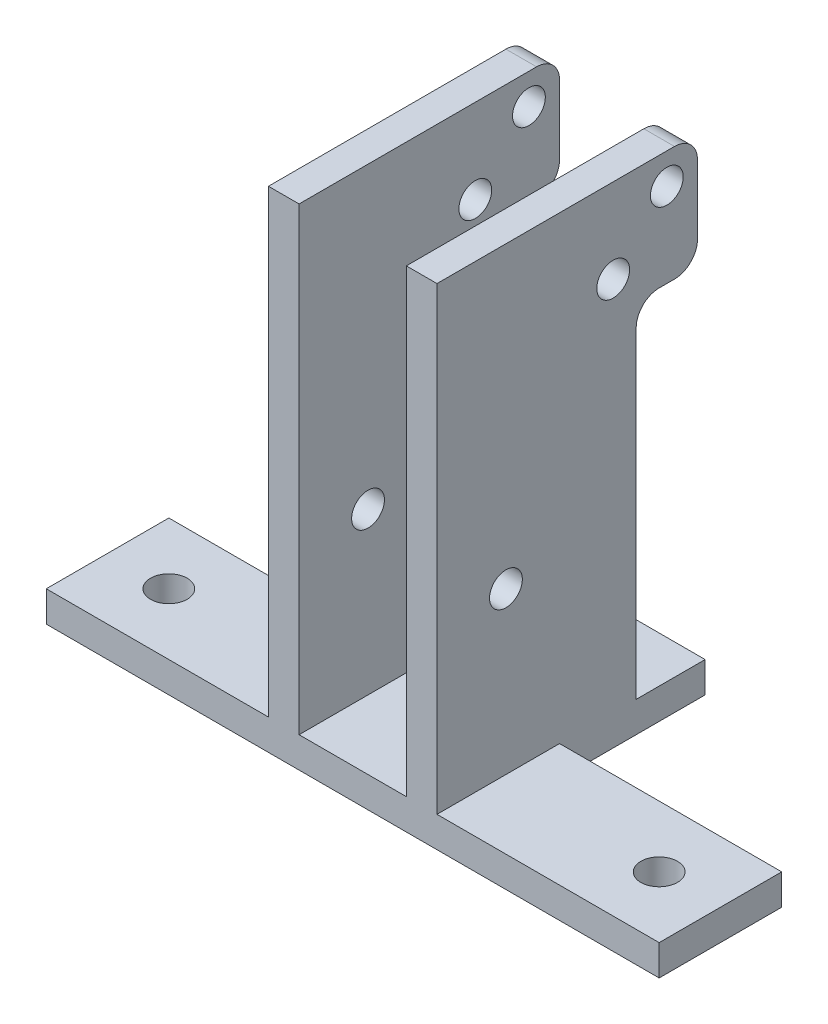
from build123d import *

# Parameters (mm, degrees)
SKETCH1_W             = 63.5
SKETCH1_H             = 6.35
BOSS_EXTRUDE1_DEPTH   = 3.175
F_6_CLEARANCE_HOLE1_D = 3.7973
SKETCH7_W             = 17.4625
SKETCH7_H             = 27.78125
BOSS_EXTRUDE2_DEPTH   = 3.175
SKETCH9_W             = 3.175
SKETCH9_H             = 20.6375
BOSS_EXTRUDE3_DEPTH   = 44.45
M3_CLEARANCE_HOLE1_D  = 3.4
SKETCH14_W            = 20.6375
SKETCH14_H            = 6.35
BOSS_EXTRUDE4_DEPTH   = 3.175
FILLET3_R             = 2.38125
M3_CLEARANCE_HOLE2_D  = 3.4
MIRROR1_START         = -8.73125
MIRROR1_OUTLINE_R     = 1.7
MIRROR1_DEPTH         = 3.175


# Read off the part's stored shape, not the designer's step: Mirror1
with BuildPart() as part:
    # Sketch1 → Boss-Extrude1 (new body)
    with BuildSketch(Plane(origin=(0, 0, 0), x_dir=(1, 0, 0), z_dir=(0, 1, 0))):
        with Locations((0, -3.175)):
            Rectangle(SKETCH1_W, SKETCH1_H)
        with Locations((0, 3.175)):
            Rectangle(SKETCH1_W, SKETCH1_H)
    extrude(amount=BOSS_EXTRUDE1_DEPTH)

    # #6 Clearance Hole1 (through all)
    with Locations(Plane(origin=(0, 0, 0), x_dir=(-1, 0, 0), z_dir=(0, -1, 0))):
        with Locations((25.4, 0), (-25.4, 0)):
            Hole(F_6_CLEARANCE_HOLE1_D / 2)

    # Sketch7 → Boss-Extrude2 (add)
    with BuildSketch(Plane.XZ):
        with Locations((0, -7.540625)):
            Rectangle(SKETCH7_W, SKETCH7_H)
    extrude(amount=-BOSS_EXTRUDE2_DEPTH)

    # Sketch9 → Boss-Extrude3 (add)
    with BuildSketch(Plane.XZ):
        with Locations((7.14375, -3.96875)):
            Rectangle(SKETCH9_W, SKETCH9_H)
        with Locations((-7.14375, -3.96875)):
            Rectangle(SKETCH9_W, SKETCH9_H)
    extrude(amount=-BOSS_EXTRUDE3_DEPTH)

    # M3 Clearance Hole1 (through all)
    with Locations(Plane(origin=(8.73125, 0, 0), x_dir=(0, 0, -1), z_dir=(1, 0, 0))):
        with Locations((0.79375, 19.84375), (11.90625, 42.06875)):
            Hole(M3_CLEARANCE_HOLE1_D / 2)

    # Sketch14 → Boss-Extrude4 (add)
    with BuildSketch(Plane(origin=(8.73125, 0, 0), x_dir=(0, 0, -1), z_dir=(1, 0, 0))):
        with Locations((3.96875, 47.625)):
            Rectangle(SKETCH14_W, SKETCH14_H)
        Polygon((14.2875, 50.8), (14.2875, 44.45), (14.2875, 38.89375), (20.6375, 38.89375), (20.6375, 50.8), align=None)
    extrude(amount=-BOSS_EXTRUDE4_DEPTH)

    # Fillet3
    fillet3_edges = [part.edges().sort_by_distance(p)[0] for p in [
        (7.14375, 50.8, -20.6375),
        (7.14375, 38.89375, -20.6375),
        (7.14375, 38.89375, -14.2875),
    ]]
    fillet(fillet3_edges, radius=FILLET3_R)

    # M3 Clearance Hole2 (through all)
    with Locations(Plane(origin=(8.73125, 0, 0), x_dir=(0, 0, -1), z_dir=(1, 0, 0))):
        with Locations((17.4625, 47.625)):
            Hole(M3_CLEARANCE_HOLE2_D / 2)

    # Mirror1 outline → Mirror1 (add)
    with BuildSketch(Plane.YZ.offset(MIRROR1_START)):
        with BuildLine():
            ThreePointArc((48.41875, -20.6375), (50.102548023, -19.940048023), (50.8, -18.25625))
            Line((50.8, -18.25625), (50.8, 6.35))
            Line((50.8, 6.35), (44.45, 6.35))
            Line((44.45, 6.35), (44.45, -14.2875))
            Line((44.45, -14.2875), (38.89375, -14.2875))
            Line((38.89375, -14.2875), (38.89375, -18.25625))
            ThreePointArc((38.89375, -18.25625), (39.591201977, -19.940048023), (41.275, -20.6375))
            Line((41.275, -20.6375), (48.41875, -20.6375))
        make_face()
        with Locations((47.625, -17.4625)):
            Circle(MIRROR1_OUTLINE_R, mode=Mode.SUBTRACT)
    extrude(amount=MIRROR1_DEPTH)


solid = part.part
